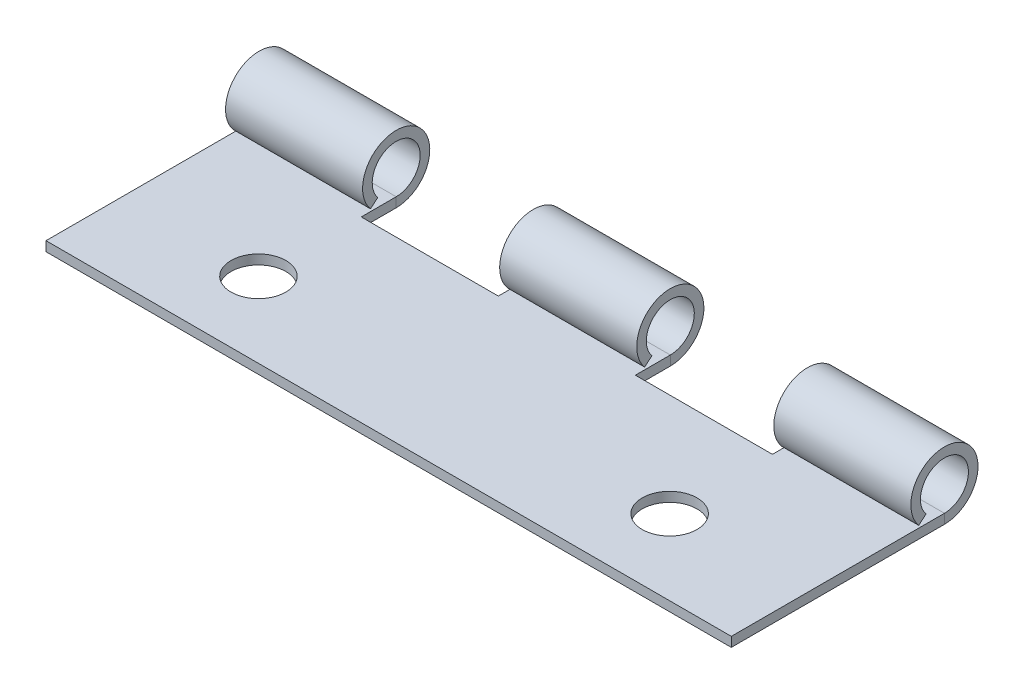
from build123d import *

# Parameters (mm, degrees)
SKETCH_1_R             = 2
SM_BASE_FLANGE_1_DEPTH = 0.7
OTHER_START            = -25
OTHER_1_DEPTH          = 50
OTHER_1_2_DEPTH        = 10
OTHER_START_2          = -5
OTHER_1_3_DEPTH        = 10
OTHER_START_3          = 15
OTHER_1_4_DEPTH        = 10


# Read off the part's stored shape, not the designer's step: 褶边1
# Sheet-metal steps are written as plain solids
with BuildPart() as part:
    # Sketch 1 → 基体-法兰1 (new body)
    with BuildSketch(Plane(origin=(0, 0, 0), x_dir=(1, 0, 0), z_dir=(0, 1, 0))):
        Polygon((0, 0), (-25, 0), (-25, 18), (-15, 18), (-15, 13), (-5, 13), (-5, 18), (5, 18), (5, 13), (15, 13), (15, 18), (25, 18), (25, 0), align=None)
        with Locations(Location((-15, 5.5, 0), (0, 0, 270))):
            Circle(SKETCH_1_R, mode=Mode.SUBTRACT)
        with Locations(Location((15, 5.5, 0), (0, 0, 90))):
            Circle(SKETCH_1_R, mode=Mode.SUBTRACT)
    extrude(amount=-SM_BASE_FLANGE_1_DEPTH)

    # Other 1 outline → Other 1 (cut)
    with BuildSketch(Plane.YZ.offset(OTHER_START)):
        with BuildLine():
            Line((0, -18), (0, -17.264642819))
            ThreePointArc((0, -17.264642819), (-0.518259244, -16.476012959), (-0.7, -15.55))
            Line((-0.7, -15.55), (-0.7, -18))
            Line((-0.7, -18), (0, -18))
        make_face()
    extrude(amount=OTHER_1_DEPTH, mode=Mode.SUBTRACT)

    # Other 1 2 outline → Other 1 2 (add)
    with BuildSketch(Plane.YZ.offset(OTHER_START)):
        with BuildLine():
            Line((0.175170356, -13.673191114), (0.625121683, -14.209422225))
            ThreePointArc((0.625121683, -14.209422225), (3.336038627, -16.289581958), (0, -15.55))
            Line((0, -15.55), (0, -17.264642819))
            ThreePointArc((0, -17.264642819), (4.197091003, -15.669355023), (0.175170356, -13.673191114))
        make_face()
    extrude(amount=OTHER_1_2_DEPTH)

    # Other 1 3 outline → Other 1 3 (add)
    with BuildSketch(Plane.YZ.offset(OTHER_START_2)):
        with BuildLine():
            Line((0.175170356, -13.673191114), (0.625121683, -14.209422225))
            ThreePointArc((0.625121683, -14.209422225), (3.336038627, -16.289581958), (0, -15.55))
            Line((0, -15.55), (0, -17.264642819))
            ThreePointArc((0, -17.264642819), (4.197091003, -15.669355023), (0.175170356, -13.673191114))
        make_face()
    extrude(amount=OTHER_1_3_DEPTH)

    # Other 1 4 outline → Other 1 4 (add)
    with BuildSketch(Plane.YZ.offset(OTHER_START_3)):
        with BuildLine():
            Line((0.175170356, -13.673191114), (0.625121683, -14.209422225))
            ThreePointArc((0.625121683, -14.209422225), (3.336038627, -16.289581958), (0, -15.55))
            Line((0, -15.55), (0, -17.264642819))
            ThreePointArc((0, -17.264642819), (4.197091003, -15.669355023), (0.175170356, -13.673191114))
        make_face()
    extrude(amount=OTHER_1_4_DEPTH)


solid = part.part
